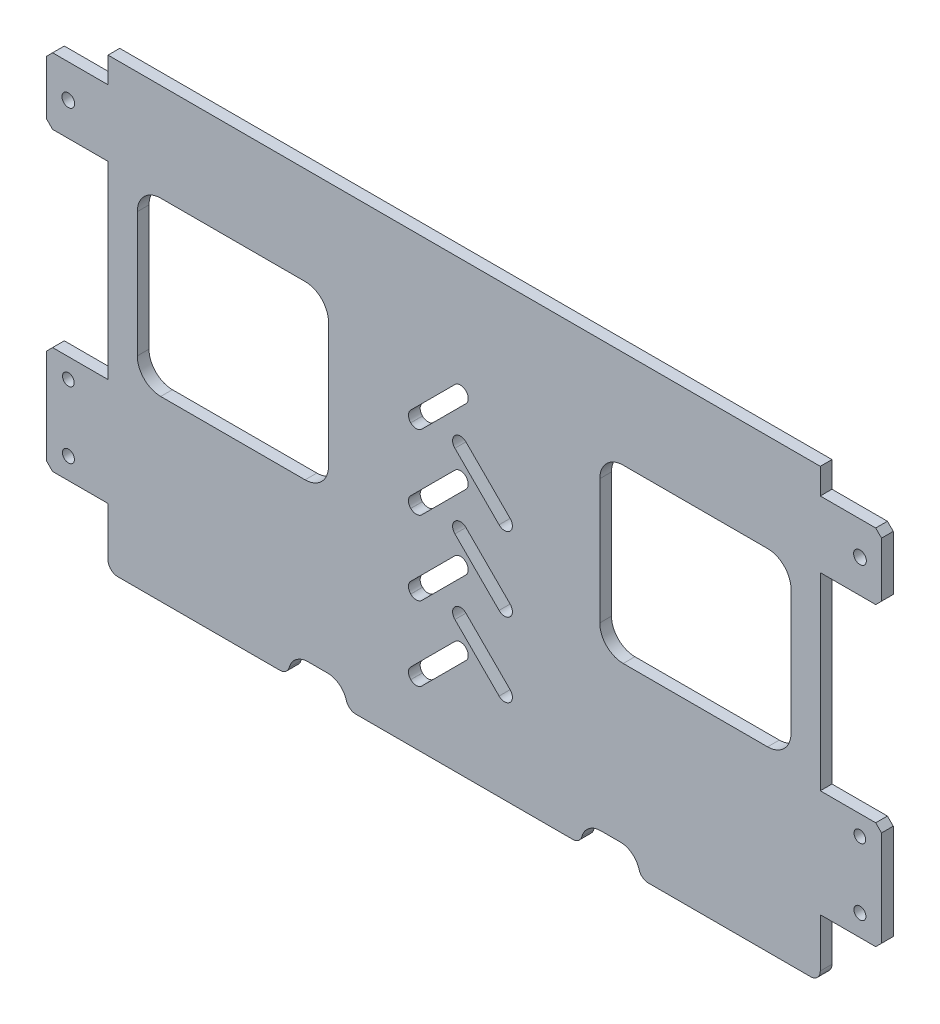
from build123d import *

# Parameters (mm, degrees)
RESSALTO_EXTRUS_O1_DEPTH = 6
ESBO_O7_W                = 6
ESBO_O7_H                = 39
CORTE_EXTRUS_O5_DEPTH    = 441.818556778
ESBO_O2_W                = 98
ESBO_O2_H                = 88
CORTE_EXTRUS_O1_DEPTH    = 10
FILETE2_R                = 12
CORTE_EXTRUS_O3_DEPTH    = 441.818556778
ESBO_O6_W                = 30
ESBO_O6_H                = 20
CORTE_EXTRUS_O4_DEPTH    = 441.818556778
FILETE3_START            = -1
FILETE3_DEPTH            = 8
FILETE3_2_DEPTH          = 6
ESBO_O8_W                = 6
ESBO_O8_H                = 34
RESSALTO_EXTRUS_O2_DEPTH = 31.4
ESBO_O9_W                = 25.4
ESBO_O9_H                = 55
RESSALTO_EXTRUS_O3_DEPTH = 6
CHANFRO1_SIZE            = 3
ESBO_O10_R               = 3.257801974
ESBO_O10_R_2             = 3
ESBO_O10_R_3             = 3.08509383
CORTE_EXTRUS_O6_DEPTH    = 463.399134947
FILETE4_R                = 5
ESBO_O11_W               = 402.172610053
ESBO_O11_H               = 13.658923547
CORTE_EXTRUS_O7_DEPTH    = 463.399134947
FILETE5_R                = 5


with BuildPart() as part:
    # Esboço1 → Ressalto-extrusão1 (new body)
    with BuildSketch(Plane.XY):
        Polygon((0, 94), (0, 238), (365, 238), (365, 94), (371, 94), (371, 0), (365, 0), (0, 0), (-6, 0), (-6, 94), align=None)
    extrude(amount=RESSALTO_EXTRUS_O1_DEPTH)

    # Esboço7 → Corte-extrusão5 (cut, through all)
    with BuildSketch(Plane.XY.offset(6)):
        with Locations((368, 19.5)):
            Rectangle(ESBO_O7_W, ESBO_O7_H)
        with Locations((-3, 19.5)):
            Rectangle(ESBO_O7_W, ESBO_O7_H)
    extrude(amount=-CORTE_EXTRUS_O5_DEPTH, mode=Mode.SUBTRACT)

    # Esboço2 → Corte-extrusão1 (cut)
    with BuildSketch(Plane.XY.offset(6)):
        with Locations((64, 144)):
            Rectangle(ESBO_O2_W, ESBO_O2_H)
        with Locations((301, 144)):
            Rectangle(ESBO_O2_W, ESBO_O2_H)
    extrude(amount=-CORTE_EXTRUS_O1_DEPTH, mode=Mode.SUBTRACT)

    # Filete2
    filete2_edges = [part.edges().sort_by_distance(p)[0] for p in [
        (15, 100, 3),
        (15, 188, 3),
        (113, 188, 3),
        (113, 100, 3),
        (350, 188, 3),
        (350, 100, 3),
        (252, 100, 3),
        (252, 188, 3),
    ]]
    fillet(filete2_edges, radius=FILETE2_R)

    # Esboço5 → Corte-extrusão3 (cut, through all)
    with BuildSketch(Plane.XY.offset(6)):
        with BuildLine():
            Line((183.428625358, 61.017420231), (160.787066224, 38.375861098))
            ThreePointArc((160.787066224, 38.375861098), (157.965710167, 37.207217155), (155.14435411, 38.375861098))
            Line((155.14435411, 38.375861098), (155.130211974, 38.390003233))
            ThreePointArc((155.130211974, 38.390003233), (153.961568031, 41.21135929), (155.130211974, 44.032715347))
            Line((155.130211974, 44.032715347), (177.771771108, 66.674274481))
            ThreePointArc((177.771771108, 66.674274481), (180.593127165, 67.842918424), (183.414483222, 66.674274481))
            Line((183.414483222, 66.674274481), (183.428625358, 66.660132345))
            ThreePointArc((183.428625358, 66.660132345), (184.597269301, 63.838776288), (183.428625358, 61.017420231))
        make_face()
        with BuildLine():
            Line((177.771771108, 82.046857483), (177.757628972, 82.032715347))
            ThreePointArc((177.757628972, 82.032715347), (176.588985029, 79.21135929), (177.757628972, 76.390003233))
            Line((177.757628972, 76.390003233), (200.399188106, 53.7484441))
            ThreePointArc((200.399188106, 53.7484441), (203.220544163, 52.579800157), (206.04190022, 53.7484441))
            Line((206.04190022, 53.7484441), (206.056042356, 53.762586235))
            ThreePointArc((206.056042356, 53.762586235), (207.224686299, 56.583942292), (206.056042356, 59.405298349))
            Line((206.056042356, 59.405298349), (183.414483222, 82.046857483))
            ThreePointArc((183.414483222, 82.046857483), (180.593127165, 83.215501426), (177.771771108, 82.046857483))
        make_face()
        with BuildLine():
            Line((183.428625358, 99.017420231), (160.787066224, 76.375861098))
            ThreePointArc((160.787066224, 76.375861098), (157.965710167, 75.207217155), (155.14435411, 76.375861098))
            Line((155.14435411, 76.375861098), (155.130211974, 76.390003233))
            ThreePointArc((155.130211974, 76.390003233), (153.961568031, 79.21135929), (155.130211974, 82.032715347))
            Line((155.130211974, 82.032715347), (177.771771108, 104.674274481))
            ThreePointArc((177.771771108, 104.674274481), (180.593127165, 105.842918424), (183.414483222, 104.674274481))
            Line((183.414483222, 104.674274481), (183.428625358, 104.660132345))
            ThreePointArc((183.428625358, 104.660132345), (184.597269301, 101.838776288), (183.428625358, 99.017420231))
        make_face()
        with BuildLine():
            Line((177.771771108, 120.046857483), (177.757628972, 120.032715347))
            ThreePointArc((177.757628972, 120.032715347), (176.588985029, 117.21135929), (177.757628972, 114.390003233))
            Line((177.757628972, 114.390003233), (200.399188106, 91.7484441))
            ThreePointArc((200.399188106, 91.7484441), (203.220544163, 90.579800157), (206.04190022, 91.7484441))
            Line((206.04190022, 91.7484441), (206.056042356, 91.762586235))
            ThreePointArc((206.056042356, 91.762586235), (207.224686299, 94.583942292), (206.056042356, 97.405298349))
            Line((206.056042356, 97.405298349), (183.414483222, 120.046857483))
            ThreePointArc((183.414483222, 120.046857483), (180.593127165, 121.215501426), (177.771771108, 120.046857483))
        make_face()
        with BuildLine():
            Line((183.428625358, 137.017420231), (160.787066224, 114.375861098))
            ThreePointArc((160.787066224, 114.375861098), (157.965710167, 113.207217155), (155.14435411, 114.375861098))
            Line((155.14435411, 114.375861098), (155.130211974, 114.390003233))
            ThreePointArc((155.130211974, 114.390003233), (153.961568031, 117.21135929), (155.130211974, 120.032715347))
            Line((155.130211974, 120.032715347), (177.771771108, 142.674274481))
            ThreePointArc((177.771771108, 142.674274481), (180.593127165, 143.842918424), (183.414483222, 142.674274481))
            Line((183.414483222, 142.674274481), (183.428625358, 142.660132345))
            ThreePointArc((183.428625358, 142.660132345), (184.597269301, 139.838776288), (183.428625358, 137.017420231))
        make_face()
        with BuildLine():
            Line((177.771771108, 158.046857483), (177.757628972, 158.032715347))
            ThreePointArc((177.757628972, 158.032715347), (176.588985029, 155.21135929), (177.757628972, 152.390003233))
            Line((177.757628972, 152.390003233), (200.399188106, 129.7484441))
            ThreePointArc((200.399188106, 129.7484441), (203.220544163, 128.579800157), (206.04190022, 129.7484441))
            Line((206.04190022, 129.7484441), (206.056042356, 129.762586235))
            ThreePointArc((206.056042356, 129.762586235), (207.224686299, 132.583942292), (206.056042356, 135.405298349))
            Line((206.056042356, 135.405298349), (183.414483222, 158.046857483))
            ThreePointArc((183.414483222, 158.046857483), (180.593127165, 159.215501426), (177.771771108, 158.046857483))
        make_face()
        with BuildLine():
            Line((183.428625358, 175.017420231), (160.787066224, 152.375861098))
            ThreePointArc((160.787066224, 152.375861098), (157.965710167, 151.207217155), (155.14435411, 152.375861098))
            Line((155.14435411, 152.375861098), (155.130211974, 152.390003233))
            ThreePointArc((155.130211974, 152.390003233), (153.961568031, 155.21135929), (155.130211974, 158.032715347))
            Line((155.130211974, 158.032715347), (177.771771108, 180.674274481))
            ThreePointArc((177.771771108, 180.674274481), (180.593127165, 181.842918424), (183.414483222, 180.674274481))
            Line((183.414483222, 180.674274481), (183.428625358, 180.660132345))
            ThreePointArc((183.428625358, 180.660132345), (184.597269301, 177.838776288), (183.428625358, 175.017420231))
        make_face()
    extrude(amount=-CORTE_EXTRUS_O3_DEPTH, mode=Mode.SUBTRACT)

    # Esboço6 → Corte-extrusão4 (cut, through all)
    with BuildSketch(Plane.XY.offset(6)):
        with Locations((107.5, 10)):
            Rectangle(ESBO_O6_W, ESBO_O6_H)
        with Locations((257.5, 10)):
            Rectangle(ESBO_O6_W, ESBO_O6_H)
    extrude(amount=-CORTE_EXTRUS_O4_DEPTH, mode=Mode.SUBTRACT)

    # Filete3: read off the stored shape, not the designer's step
    # Filete3 outline → Filete3 (cut)
    with BuildSketch(Plane.XY.offset(FILETE3_START)):
        with BuildLine():
            ThreePointArc((282.5, 0), (275.428932188, 2.928932188), (272.5, 10))
            Line((272.5, 10), (272.5, 0))
            Line((272.5, 0), (282.5, 0))
        make_face()
        with BuildLine():
            Line((92.5, 0), (92.5, 10))
            ThreePointArc((92.5, 10), (89.571067812, 2.928932188), (82.5, 0))
            Line((82.5, 0), (92.5, 0))
        make_face()
        with BuildLine():
            Line((122.5, 0), (132.5, 0))
            ThreePointArc((132.5, 0), (125.428932188, 2.928932188), (122.5, 10))
            Line((122.5, 10), (122.5, 0))
        make_face()
        with BuildLine():
            Line((242.5, 0), (242.5, 10))
            ThreePointArc((242.5, 10), (239.571067812, 2.928932188), (232.5, 0))
            Line((232.5, 0), (242.5, 0))
        make_face()
    extrude(amount=FILETE3_DEPTH, mode=Mode.SUBTRACT)

    # Filete3 2 outline → Filete3 2 (add)
    with BuildSketch(Plane.XY):
        with BuildLine():
            Line((272.5, 20), (262.5, 20))
            ThreePointArc((262.5, 20), (269.571067812, 17.071067812), (272.5, 10))
            Line((272.5, 10), (272.5, 20))
        make_face()
        with BuildLine():
            ThreePointArc((92.5, 10), (95.428932188, 17.071067812), (102.5, 20))
            Line((102.5, 20), (92.5, 20))
            Line((92.5, 20), (92.5, 10))
        make_face()
        with BuildLine():
            ThreePointArc((112.5, 20), (119.571067812, 17.071067812), (122.5, 10))
            Line((122.5, 10), (122.5, 20))
            Line((122.5, 20), (112.5, 20))
        make_face()
        with BuildLine():
            ThreePointArc((242.5, 10), (245.428932188, 17.071067812), (252.5, 20))
            Line((252.5, 20), (242.5, 20))
            Line((242.5, 20), (242.5, 10))
        make_face()
    extrude(amount=FILETE3_2_DEPTH)

    # Esboço8 → Ressalto-extrusão2 (add)
    with BuildSketch(Plane(origin=(365, 0, 0), x_dir=(0, 0, -1), z_dir=(1, 0, 0))):
        with Locations((-3, 207.827931833)):
            Rectangle(ESBO_O8_W, ESBO_O8_H)
    ressalto_extrus_o2 = extrude(amount=RESSALTO_EXTRUS_O2_DEPTH)

    # Espelhar1: Ressalto-extrusão2 across plane
    add(ressalto_extrus_o2.mirror(Plane.ZY.offset(-182.5)))

    # Esboço9 → Ressalto-extrusão3 (add, through all)
    with BuildSketch(Plane.XY.offset(6)):
        with Locations((383.7, 66.5)):
            Rectangle(ESBO_O9_W, ESBO_O9_H)
        with Locations((-18.7, 66.5)):
            Rectangle(ESBO_O9_W, ESBO_O9_H)
    extrude(amount=-RESSALTO_EXTRUS_O3_DEPTH)

    # Chanfro1
    chanfro1_edges = [part.edges().sort_by_distance(p)[0] for p in [
        (396.4, 224.827931833, 3),
        (396.4, 190.827931833, 3),
        (-31.4, 224.827931833, 3),
        (-31.4, 190.827931833, 3),
        (396.4, 94, 3),
        (396.4, 39, 3),
        (-31.4, 39, 3),
        (-31.4, 94, 3),
    ]]
    chamfer(chanfro1_edges, length=CHANFRO1_SIZE)

    # Esboço10 → Corte-extrusão6 (cut, through all)
    with BuildSketch(Plane.XY.offset(6)):
        with Locations((385.342976088, 207.820691694)):
            Circle(ESBO_O10_R)
        with Locations((385.3, 83.913025663)):
            Circle(ESBO_O10_R_2)
        with Locations((385.3, 49.913025663)):
            Circle(ESBO_O10_R_3)
        with Locations(Location((-20.3, 49.913025663, 0), (0, 0, 180))):
            Circle(ESBO_O10_R_3)
        with Locations(Location((-20.3, 83.913025663, 0), (0, 0, 180))):
            Circle(ESBO_O10_R_2)
        with Locations(Location((-20.342976088, 207.820691694, 0), (0, 0, 180))):
            Circle(ESBO_O10_R)
    extrude(amount=-CORTE_EXTRUS_O6_DEPTH, mode=Mode.SUBTRACT)

    # Filete4
    filete4_edges = [part.edges().sort_by_distance(p)[0] for p in [
        (365, 0, 3),
        (0, 0, 3),
    ]]
    fillet(filete4_edges, radius=FILETE4_R)

    # Esboço11 → Corte-extrusão7 (cut, through all)
    with BuildSketch(Plane.XY.offset(6)):
        with Locations((201.086305027, 2.170538226)):
            Rectangle(ESBO_O11_W, ESBO_O11_H)
    extrude(amount=-CORTE_EXTRUS_O7_DEPTH, mode=Mode.SUBTRACT)

    # Filete5
    filete5_edges = [part.edges().sort_by_distance(p)[0] for p in [
        (0, 9, 3),
        (122.550125629, 9, 3),
        (92.449874371, 9, 3),
        (242.449874371, 9, 3),
        (272.550125629, 9, 3),
        (365, 9, 3),
    ]]
    fillet(filete5_edges, radius=FILETE5_R)


solid = part.part
